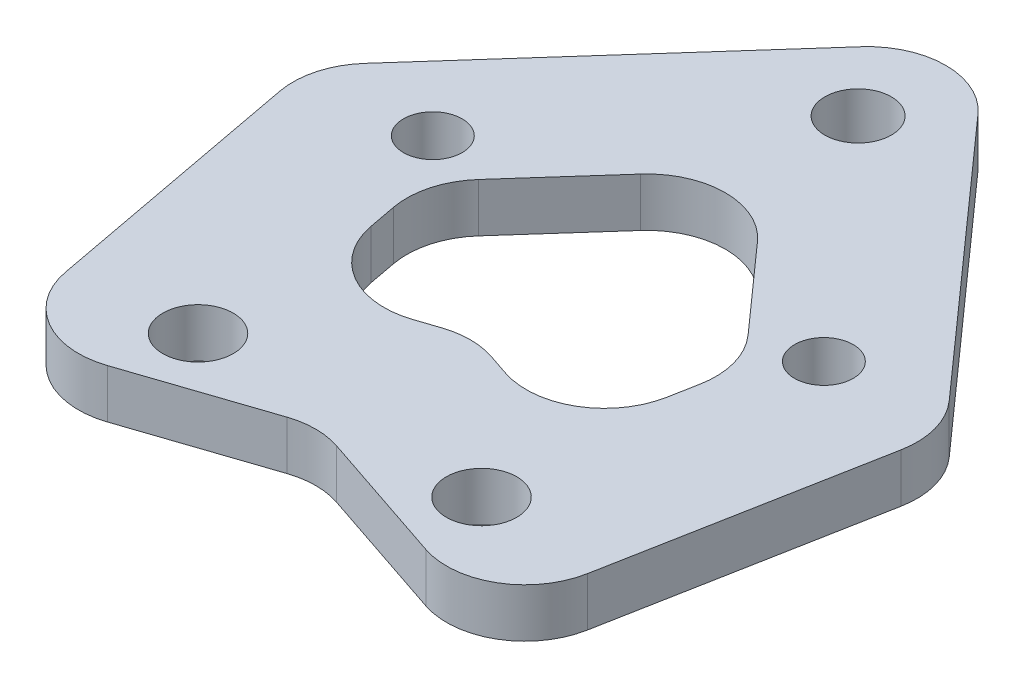
from build123d import *

# Parameters (mm, degrees)
BOSS_EXTRUDE1_DEPTH = 1.5875
SKETCH2_R           = 1.905000001
SKETCH2_R_2         = 1.905000002
SKETCH2_R_3         = 2.158999998
SKETCH2_R_4         = 2.286
CUT_EXTRUDE1_DEPTH  = 69.454207552
CUT_EXTRUDE3_DEPTH  = 69.454207552
FILLET2_R           = 5.08


with BuildPart() as part:
    # Sketch1 → Boss-Extrude1 (new, symmetric)
    with BuildSketch(Plane(origin=(0, 0, 0), x_dir=(1, 0, 0), z_dir=(0, 1, 0))):
        Polygon((11.7475, 20.002500004), (32.385, 43.180000004), (53.0225, 20.002500004), (48.259999997, -5.350948548), (32.384999996, -0.023080643), (16.509999997, -5.350948549), align=None)
    extrude(amount=BOSS_EXTRUDE1_DEPTH, both=True)

    # Sketch2 → Cut-Extrude1 (cut, through all)
    with BuildSketch(Plane(origin=(0, -1.5875, 0), x_dir=(1, 0, 0), z_dir=(0, 1, 0))):
        with Locations((19.684999998, 20.002500002)):
            Circle(SKETCH2_R)
        with Locations((45.084999998, 20.0025)):
            Circle(SKETCH2_R_2)
        with Locations((32.385, 34.925000025)):
            Circle(SKETCH2_R_3)
        with Locations((23.1775, 1.25970321)):
            Circle(SKETCH2_R_4)
        with Locations((41.5925, 1.25970321)):
            Circle(SKETCH2_R_4)
    extrude(amount=CUT_EXTRUDE1_DEPTH, mode=Mode.SUBTRACT)

    # Sketch4 → Cut-Extrude3 (cut, through all)
    with BuildSketch(Plane(origin=(0, 1.5875, 0), x_dir=(1, 0, 0), z_dir=(0, 1, 0))):
        Polygon((21.972536983, 17.162664889), (23.851467105, 7.160069988), (32.384999996, 10.024040761), (40.918532891, 7.160069987), (42.797463016, 17.16266489), (32.385, 28.856661816), align=None)
    extrude(amount=-CUT_EXTRUDE3_DEPTH, mode=Mode.SUBTRACT)

    # Fillet2
    fillet2_edges = [part.edges().sort_by_distance(p)[0] for p in [
        (23.851467105, 0, -7.160069988),
        (32.384999996, 0, -10.024040761),
        (40.918532891, 0, -7.160069987),
        (42.797463016, 0, -17.16266489),
        (32.385, 0, -28.856661816),
        (21.972536983, 0, -17.162664889),
        (11.7475, 0, -20.002500004),
        (32.385, 0, -43.180000004),
        (53.0225, 0, -20.002500004),
        (32.384999996, 0, 0.023080643),
        (16.509999997, 0, 5.350948549),
        (48.259999997, 0, 5.350948548),
    ]]
    fillet(fillet2_edges, radius=FILLET2_R)


solid = part.part
